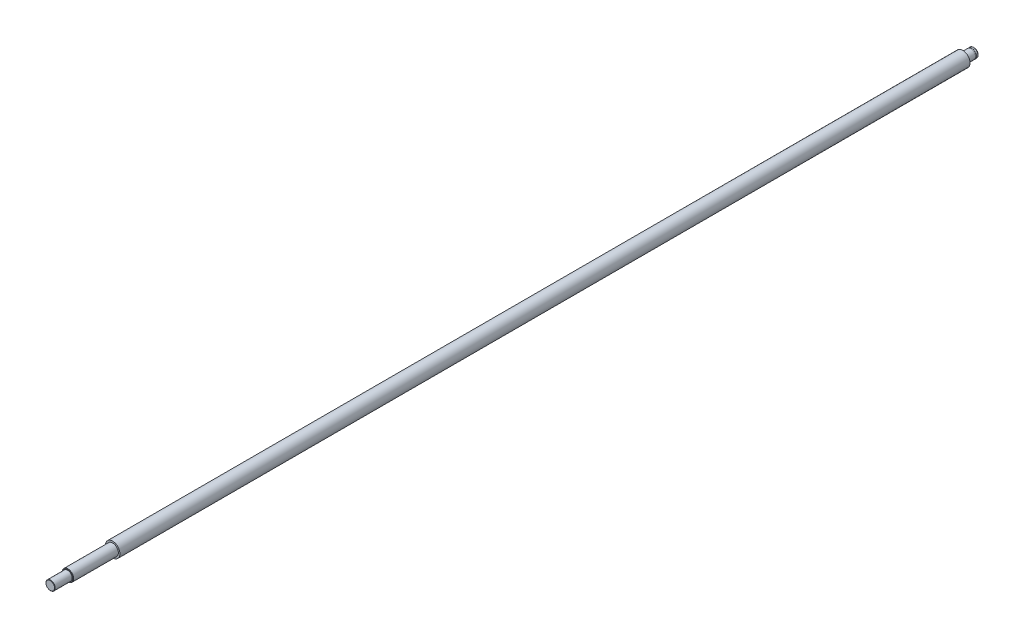
from build123d import *

# Parameters (mm, degrees)
SKETCH2_W     = 0.9
SKETCH2_H     = 0.2
CHAMFER1_SIZE = 0.8
CHAMFER2_SIZE = 0.3


with BuildPart() as part:
    # Sketch1 → Revolve1 (revolve)
    with BuildSketch(Plane(origin=(0, 0, 0), x_dir=(0, 0, -1), z_dir=(1, 0, 0))):
        Polygon((-400, 0), (400, 0), (400, 4), (390, 4), (390, 6.32), (-346, 6.32), (-346, 4.94), (-385, 4.94), (-385, 4), (-400, 4), align=None)
    revolve(axis=Axis((0, 0, 400), (0, 0, -1)))

    # Sketch2 → Cut-Revolve1 (revolve, cut)
    with BuildSketch(Plane(origin=(0, 0, 0), x_dir=(0, 0, -1), z_dir=(1, 0, 0))):
        with Locations((397.45, 3.9)):
            Rectangle(SKETCH2_W, SKETCH2_H)
    revolve(axis=Axis((0, 0, -400), (0, 0, 1)), mode=Mode.SUBTRACT)

    # Chamfer1
    chamfer1_edges = [part.edges().sort_by_distance(p)[0] for p in [
        (0, -4, -400),
    ]]
    chamfer(chamfer1_edges, length=CHAMFER1_SIZE)

    # Chamfer2
    chamfer2_edges = [part.edges().sort_by_distance(p)[0] for p in [
        (0, -4, 400),
        (0, -4.94, 385),
    ]]
    chamfer(chamfer2_edges, length=CHAMFER2_SIZE)


solid = part.part
